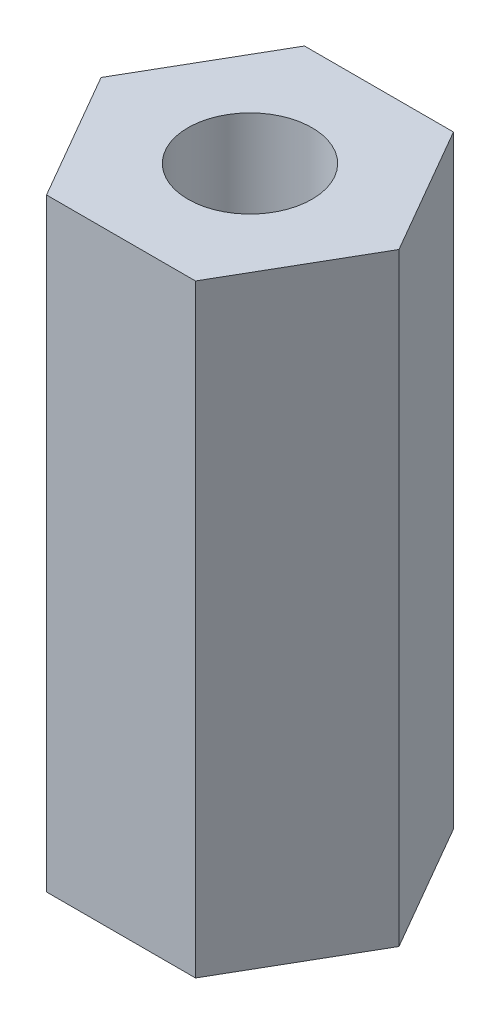
from build123d import *

# Parameters (mm, degrees)
BOSS_EXTRUDE1_DEPTH          = 10.95
F_2_25_2_25_DIAMETER_HOLE1_D = 2.25


with BuildPart() as part:
    # Sketch1 → Boss-Extrude1 (new body)
    with BuildSketch(Plane(origin=(0, 0, 0), x_dir=(1, 0, 0), z_dir=(0, 1, 0))):
        Polygon((2.70199926, 0), (1.35099963, 2.34), (-1.35099963, 2.34), (-2.70199926, 0), (-1.35099963, -2.34), (1.35099963, -2.34), align=None)
    extrude(amount=BOSS_EXTRUDE1_DEPTH)

    # Ø2.25 (2.25) Diameter Hole1 (through all)
    with Locations(Plane(origin=(0, 10.95, 0), x_dir=(1, 0, 0), z_dir=(0, 1, 0))):
        with Locations((0, 0)):
            Hole(F_2_25_2_25_DIAMETER_HOLE1_D / 2)


solid = part.part
